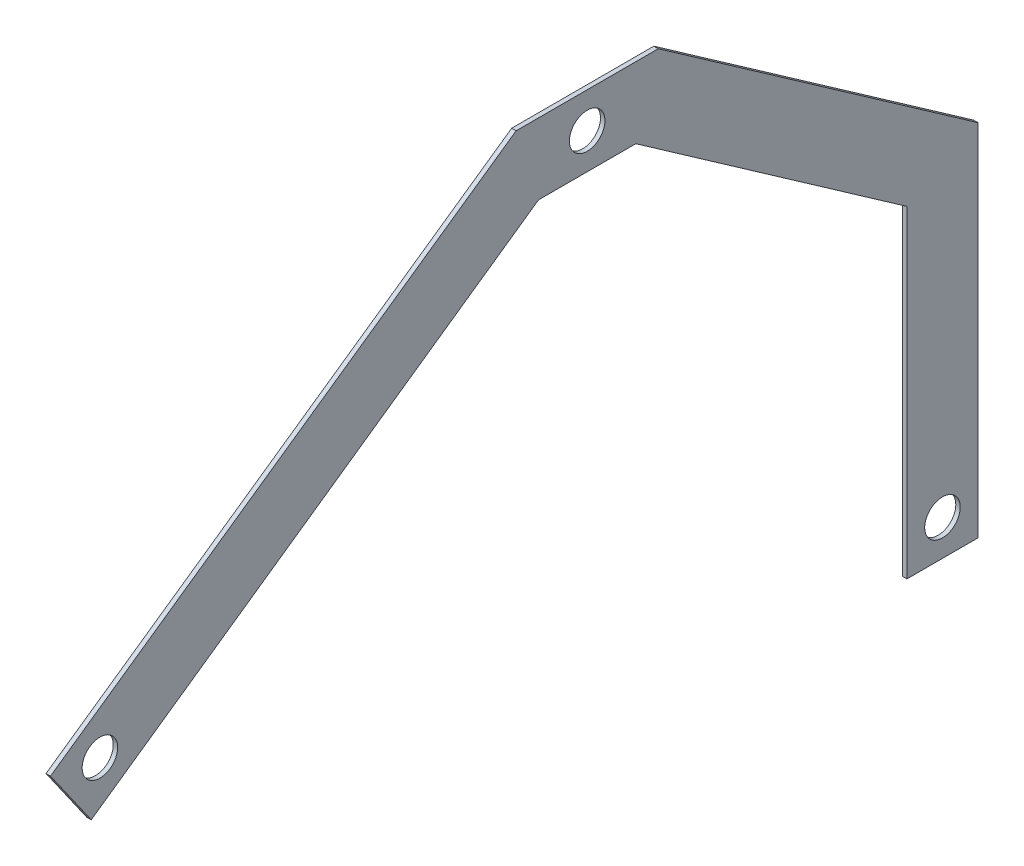
from build123d import *

# Parameters (mm, degrees)
SKETCH1_R           = 12.7
BOSS_EXTRUDE1_DEPTH = 3.175
SKETCH3_R           = 12.7
CUT_EXTRUDE2_DEPTH  = 549.359264357


with BuildPart() as part:
    # Sketch1 → Boss-Extrude1 (new body)
    with BuildSketch(Plane(origin=(0, 0, 0), x_dir=(0, 0, -1), z_dir=(1, 0, 0))):
        Polygon((-50.8, 25.4), (50.8, 25.4), (279.4, -134.667443235), (279.4, -391.739084175), (228.6, -391.739084175), (228.6, -161.112249403), (34.782821525, -25.4), (-34.782821525, -25.4), (-354.565707832, -249.314387583), (-383.703390799, -207.701463733), align=None)
        with Locations((-348.328087391, -213.939084175)):
            Circle(SKETCH1_R, mode=Mode.SUBTRACT)
        Circle(SKETCH1_R, mode=Mode.SUBTRACT)
    extrude(amount=BOSS_EXTRUDE1_DEPTH)

    # Sketch3 → Cut-Extrude2 (cut, through all)
    with BuildSketch(Plane(origin=(3.175, 0, 0), x_dir=(0, 0, -1), z_dir=(1, 0, 0))):
        with Locations((254, -366.339084175)):
            Circle(SKETCH3_R)
    extrude(amount=-CUT_EXTRUDE2_DEPTH, mode=Mode.SUBTRACT)


solid = part.part
